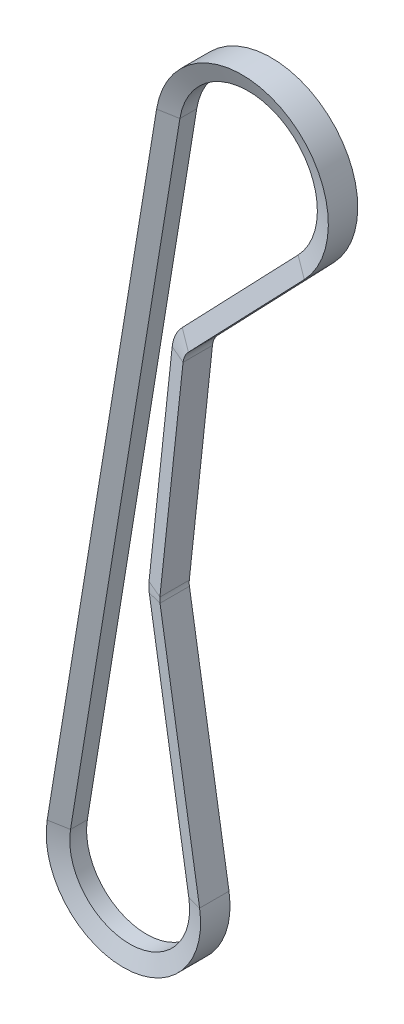
from build123d import *


with BuildPart() as part:
    # Sweep1: sweep along a path in Sketch2
    with BuildLine(Plane.XY) as sweep1_path:
        Line((-24.673854517, 4.025034567), (10.743156308, 221.13476568))
        ThreePointArc((10.743156308, 221.13476568), (50.886896241, 241.677163024), (58.585199428, 197.244674095))
        Line((58.585199428, 197.244674095), (21.057286735, 158.11885119))
        ThreePointArc((21.057286735, 158.11885119), (19.884135569, 156.405124662), (19.326669114, 154.404531393))
        Line((19.326669114, 154.404531393), (11.816794538, 84.808541682))
        ThreePointArc((11.816794538, 84.808541682), (11.782384084, 83.95867403), (11.861864025, 83.111831632))
        Line((11.861864025, 83.111831632), (24.678271684, 3.997862764))
        ThreePointArc((24.678271684, 3.997862764), (-0.013764249, -24.999996211), (-24.673854517, 4.025034567))
    # Sketch3 → Sweep1 (sweep)
    with BuildSketch(Plane(origin=(24.678271684, 3.997862764, 0), x_dir=(-0.9871308673706942, -0.15991451054854575, 0), z_dir=(0.15991451054854575, -0.9871308673706942, 0))):
        Polygon((0, -4.7625), (0, 4.7625), (5.588, 2.728634331), (5.588, -2.728634331), align=None)
    sweep(path=sweep1_path.line)


solid = part.part
